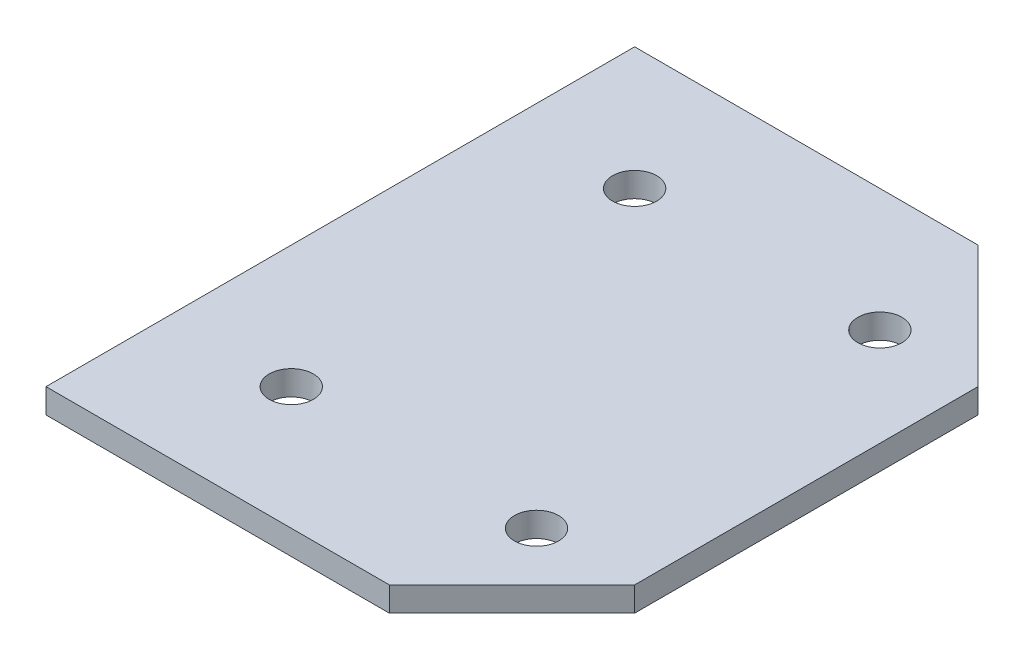
from build123d import *

# Parameters (mm, degrees)
BOSS_EXTRUDE1_DEPTH = 1
SKETCH2_R           = 0.9
CUT_EXTRUDE1_DEPTH  = 85.182158204


with BuildPart() as part:
    # Sketch1 → Boss-Extrude1 (new body)
    with BuildSketch(Plane(origin=(0, 0, 0), x_dir=(1, 0, 0), z_dir=(0, 1, 0))):
        Polygon((43.27450468, -56.634987656), (43.27450468, -32.634987656), (57.27450468, -32.634987656), (62.27450468, -37.634987656), (62.27450468, -51.634987656), (57.27450468, -56.634987656), align=None)
    extrude(amount=BOSS_EXTRUDE1_DEPTH)

    # Sketch2 → Cut-Extrude1 (cut, through all)
    with BuildSketch(Plane(origin=(0, 1, 0), x_dir=(1, 0, 0), z_dir=(0, 1, 0))):
        with Locations((58.27450468, -51.634987656)):
            Circle(SKETCH2_R)
        with Locations((48.27450468, -51.634987656)):
            Circle(SKETCH2_R)
        with Locations((48.27450468, -37.634987656)):
            Circle(SKETCH2_R)
        with Locations((58.27450468, -37.634987656)):
            Circle(SKETCH2_R)
    extrude(amount=-CUT_EXTRUDE1_DEPTH, mode=Mode.SUBTRACT)


solid = part.part
